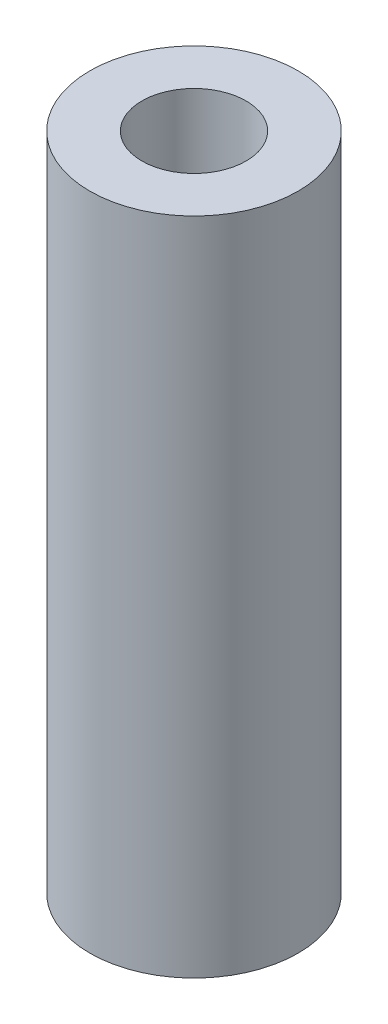
from build123d import *

# Parameters (mm, degrees)
SKETCH1_R           = 3
SKETCH1_R_2         = 1.5
BOSS_EXTRUDE1_DEPTH = 19


with BuildPart() as part:
    # Sketch1 → Boss-Extrude1 (new body)
    with BuildSketch(Plane(origin=(0, 0, 0), x_dir=(1, 0, 0), z_dir=(0, 1, 0))):
        Circle(SKETCH1_R)
        Circle(SKETCH1_R_2, mode=Mode.SUBTRACT)
    extrude(amount=BOSS_EXTRUDE1_DEPTH)


solid = part.part
